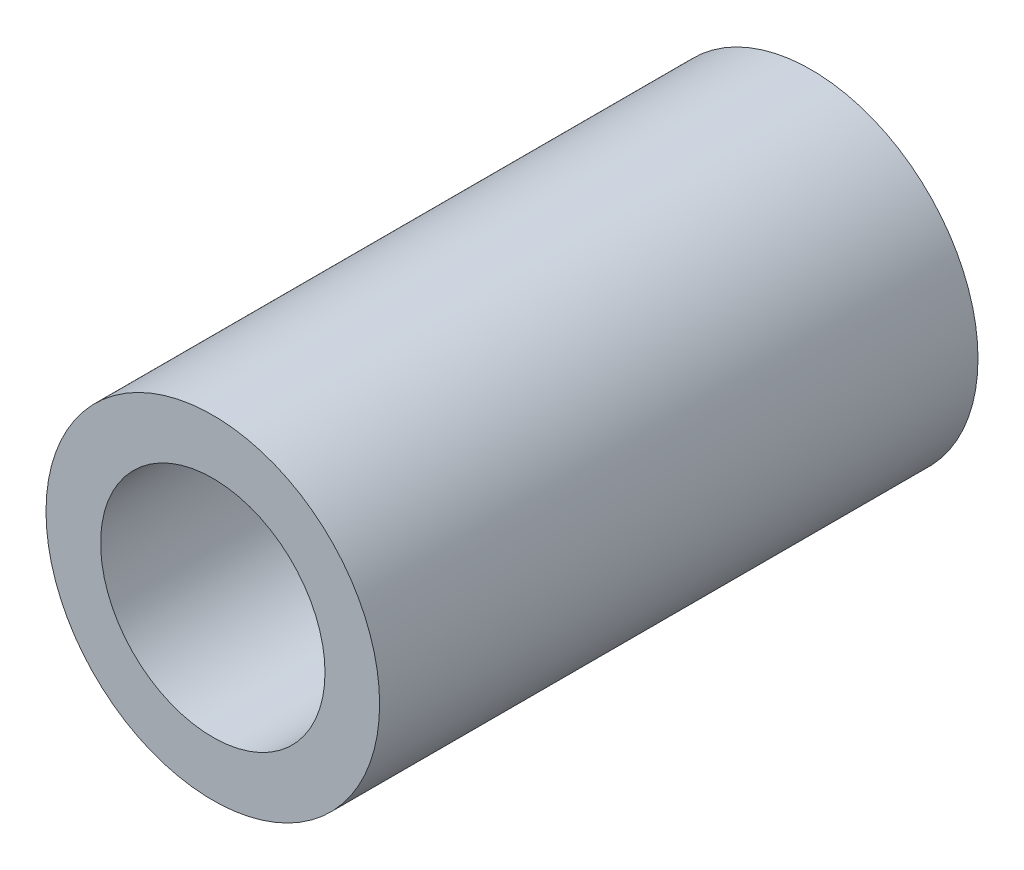
from build123d import *

# Parameters (mm, degrees)
SKETCH1_R           = 14.1605
SKETCH1_R_2         = 9.525
BOSS_EXTRUDE1_DEPTH = 25.4


with BuildPart() as part:
    # Sketch1 → Boss-Extrude1 (new, symmetric)
    with BuildSketch(Plane.XY):
        Circle(SKETCH1_R)
        Circle(SKETCH1_R_2, mode=Mode.SUBTRACT)
    extrude(amount=BOSS_EXTRUDE1_DEPTH, both=True)


solid = part.part
